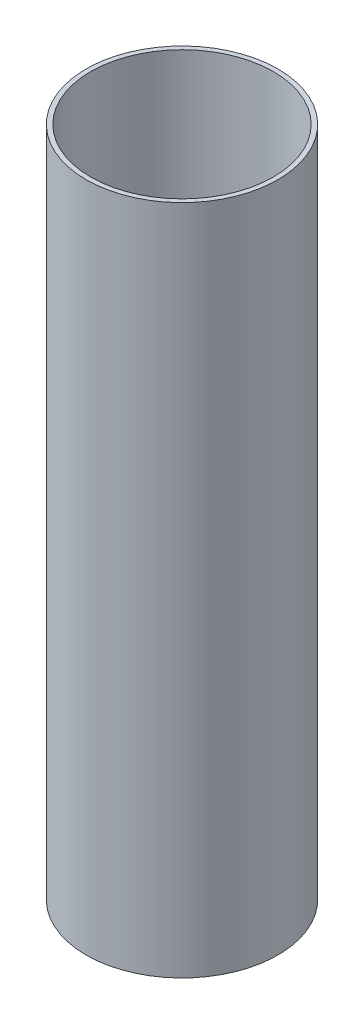
from build123d import *

# Parameters (mm, degrees)
SKETCH3_R           = 21
BOSS_EXTRUDE2_DEPTH = 2
SKETCH4_R           = 10.05
CUT_EXTRUDE2_DEPTH  = 12.5
SKETCH5_R           = 21
BOSS_EXTRUDE3_DEPTH = 24
SKETCH6_R           = 20
CUT_EXTRUDE3_DEPTH  = 24
SKETCH7_R           = 21
BOSS_EXTRUDE4_DEPTH = 12.5
SKETCH8_R           = 10.05
CUT_EXTRUDE4_DEPTH  = 12.5
SKETCH9_R           = 21
BOSS_EXTRUDE5_DEPTH = 19
SKETCH10_R          = 20
CUT_EXTRUDE5_DEPTH  = 19
SKETCH11_R          = 21
BOSS_EXTRUDE6_DEPTH = 14.5
SKETCH12_R          = 7.5
CUT_EXTRUDE6_DEPTH  = 14.5
SKETCH13_R          = 21
BOSS_EXTRUDE7_DEPTH = 75
SKETCH14_R          = 20
CUT_EXTRUDE7_DEPTH  = 75
CHAMFER7_SIZE       = 11
CHAMFER8_SIZE       = 12.5


# Some blends are built 0.0001 mm under size
with BuildPart() as part:
    # Sketch3 → Boss-Extrude2 (new body)
    with BuildSketch(Plane(origin=(0, 0, 0), x_dir=(1, 0, 0), z_dir=(0, 1, 0))):
        with Locations(Location((0, 0, 0), (0, 0, 270))):
            Circle(SKETCH3_R)
    extrude(amount=BOSS_EXTRUDE2_DEPTH)

    # Sketch4 → Cut-Extrude2 (cut)
    with BuildSketch(Plane(origin=(0, 2, 0), x_dir=(1, 0, 0), z_dir=(0, 1, 0))):
        with Locations(Location((0, 0, 0), (0, 0, 270))):
            Circle(SKETCH4_R)
    extrude(amount=-CUT_EXTRUDE2_DEPTH, mode=Mode.SUBTRACT)

    # Sketch5 → Boss-Extrude3 (add)
    with BuildSketch(Plane(origin=(0, 2, 0), x_dir=(1, 0, 0), z_dir=(0, 1, 0))):
        with Locations(Location((0, 0, 0), (0, 0, 270))):
            Circle(SKETCH5_R)
    extrude(amount=BOSS_EXTRUDE3_DEPTH)

    # Sketch6 → Cut-Extrude3 (cut)
    with BuildSketch(Plane(origin=(0, 26, 0), x_dir=(1, 0, 0), z_dir=(0, 1, 0))):
        with Locations(Location((0, 0, 0), (0, 0, 270))):
            Circle(SKETCH6_R)
    extrude(amount=-CUT_EXTRUDE3_DEPTH, mode=Mode.SUBTRACT)

    # Sketch7 → Boss-Extrude4 (add)
    with BuildSketch(Plane(origin=(0, 26, 0), x_dir=(1, 0, 0), z_dir=(0, 1, 0))):
        with Locations(Location((0, 0, 0), (0, 0, 270))):
            Circle(SKETCH7_R)
    extrude(amount=BOSS_EXTRUDE4_DEPTH)

    # Sketch8 → Cut-Extrude4 (cut)
    with BuildSketch(Plane(origin=(0, 38.5, 0), x_dir=(1, 0, 0), z_dir=(0, 1, 0))):
        with Locations(Location((0, 0, 0), (0, 0, 270))):
            Circle(SKETCH8_R)
    extrude(amount=-CUT_EXTRUDE4_DEPTH, mode=Mode.SUBTRACT)

    # Sketch9 → Boss-Extrude5 (add)
    with BuildSketch(Plane(origin=(0, 38.5, 0), x_dir=(1, 0, 0), z_dir=(0, 1, 0))):
        with Locations(Location((0, 0, 0), (0, 0, 270))):
            Circle(SKETCH9_R)
    extrude(amount=BOSS_EXTRUDE5_DEPTH)

    # Sketch10 → Cut-Extrude5 (cut)
    with BuildSketch(Plane(origin=(0, 57.5, 0), x_dir=(1, 0, 0), z_dir=(0, 1, 0))):
        with Locations(Location((0, 0, 0), (0, 0, 270))):
            Circle(SKETCH10_R)
    extrude(amount=-CUT_EXTRUDE5_DEPTH, mode=Mode.SUBTRACT)

    # Sketch11 → Boss-Extrude6 (add)
    with BuildSketch(Plane(origin=(0, 57.5, 0), x_dir=(1, 0, 0), z_dir=(0, 1, 0))):
        with Locations(Location((0, 0, 0), (0, 0, 270))):
            Circle(SKETCH11_R)
    extrude(amount=BOSS_EXTRUDE6_DEPTH)

    # Sketch12 → Cut-Extrude6 (cut)
    with BuildSketch(Plane(origin=(0, 72, 0), x_dir=(1, 0, 0), z_dir=(0, 1, 0))):
        with Locations(Location((0, 0, 0), (0, 0, 270))):
            Circle(SKETCH12_R)
    extrude(amount=-CUT_EXTRUDE6_DEPTH, mode=Mode.SUBTRACT)

    # Sketch13 → Boss-Extrude7 (add)
    with BuildSketch(Plane(origin=(0, 72, 0), x_dir=(1, 0, 0), z_dir=(0, 1, 0))):
        with Locations(Location((0, 0, 0), (0, 0, 270))):
            Circle(SKETCH13_R)
    extrude(amount=BOSS_EXTRUDE7_DEPTH)

    # Sketch14 → Cut-Extrude7 (cut)
    with BuildSketch(Plane(origin=(0, 147, 0), x_dir=(1, 0, 0), z_dir=(0, 1, 0))):
        with Locations(Location((0, 0, 0), (0, 0, 270))):
            Circle(SKETCH14_R)
    extrude(amount=-CUT_EXTRUDE7_DEPTH, mode=Mode.SUBTRACT)

    # Chamfer7
    # the kernel refuses this chamfer: 11 mm, written as the material it takes off along each edge
    with BuildSketch(Plane(origin=(0, 26, 0), x_dir=(0, 0, 1), z_dir=(-1, 0, 0))) as chamfer7_piece_1_section:
        Polygon((10.05 + CHAMFER7_SIZE, 0), (10.05, CHAMFER7_SIZE), (10.05, 0), align=None)
    chamfer7_piece_1 = revolve(axis=Axis((0, 26, 0), (0, 1, 0)), mode=Mode.PRIVATE)
    chamfer7_piece_1 = chamfer7_piece_1 & Plane(origin=(0, 32.05519731, 0), x_dir=(0, 0, 1), z_dir=(0, 1, 0)) * Cylinder(20, 85, mode=Mode.PRIVATE)
    add(chamfer7_piece_1, mode=Mode.SUBTRACT)

    # Chamfer8
    chamfer8_edges = [part.edges().sort_by_distance(p)[0] for p in [
        (0, 57.5, -7.5),
    ]]
    chamfer(chamfer8_edges, length=CHAMFER8_SIZE - 0.0001)  # a hair under: the kernel refuses the full size


solid = part.part
